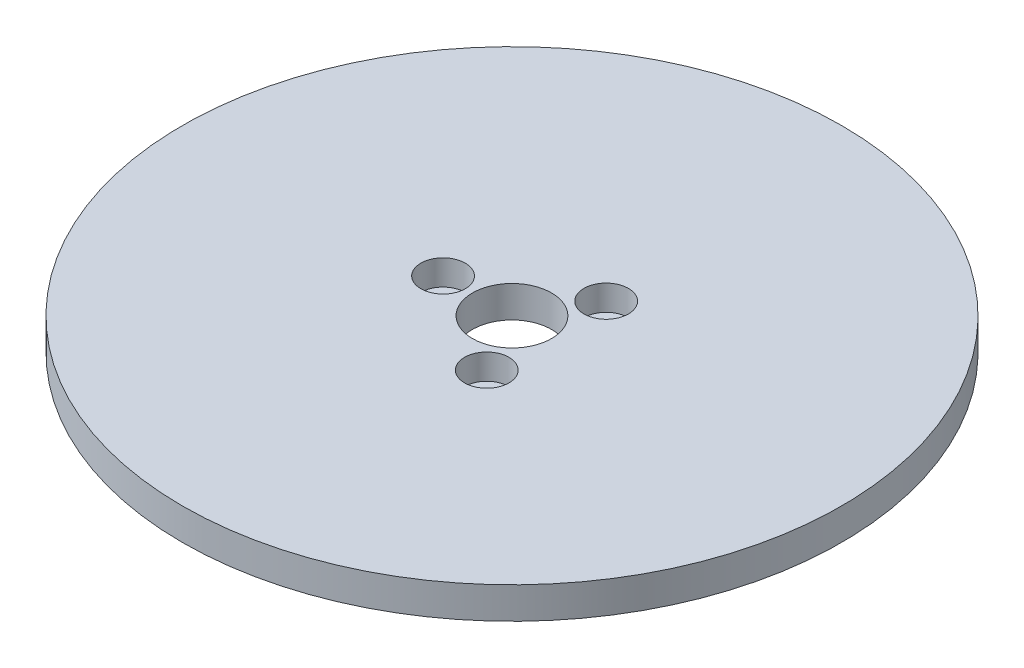
from build123d import *

# Parameters (mm, degrees)
SKETCH1_R           = 62.5
BOSS_EXTRUDE1_DEPTH = 6
SKETCH2_R           = 7.5
CUT_EXTRUDE1_DEPTH  = 89.591760339
SKETCH3_R           = 4.213148027
CUT_EXTRUDE2_DEPTH  = 4.810618204
CIRPATTERN1_COUNT   = 3


with BuildPart() as part:
    # Sketch1 → Boss-Extrude1 (new body)
    with BuildSketch(Plane(origin=(0, 0, 0), x_dir=(1, 0, 0), z_dir=(0, 1, 0))):
        Circle(SKETCH1_R)
    extrude(amount=BOSS_EXTRUDE1_DEPTH)

    # Sketch2 → Cut-Extrude1 (cut, through all)
    with BuildSketch(Plane(origin=(0, 0, 0), x_dir=(1, 0, 0), z_dir=(0, 1, 0))):
        Circle(SKETCH2_R)
    extrude(amount=CUT_EXTRUDE1_DEPTH, mode=Mode.SUBTRACT)

    # Sketch3 → Cut-Extrude2 (cut)
    with BuildSketch(Plane(origin=(0, 6, 0), x_dir=(1, 0, 0), z_dir=(0, 1, 0))):
        with Locations((-13.072999483, 0)):
            Circle(SKETCH3_R)
    cut_extrude2 = extrude(amount=-CUT_EXTRUDE2_DEPTH, mode=Mode.SUBTRACT)

    # CirPattern1: Cut-Extrude2 ×3 about axis
    cirpattern1_axis = Axis((0, 0, 0), (0, 1, 0))
    for i in range(1, CIRPATTERN1_COUNT):
        add(cut_extrude2.rotate(cirpattern1_axis, i * 360 / CIRPATTERN1_COUNT), mode=Mode.SUBTRACT)


solid = part.part
